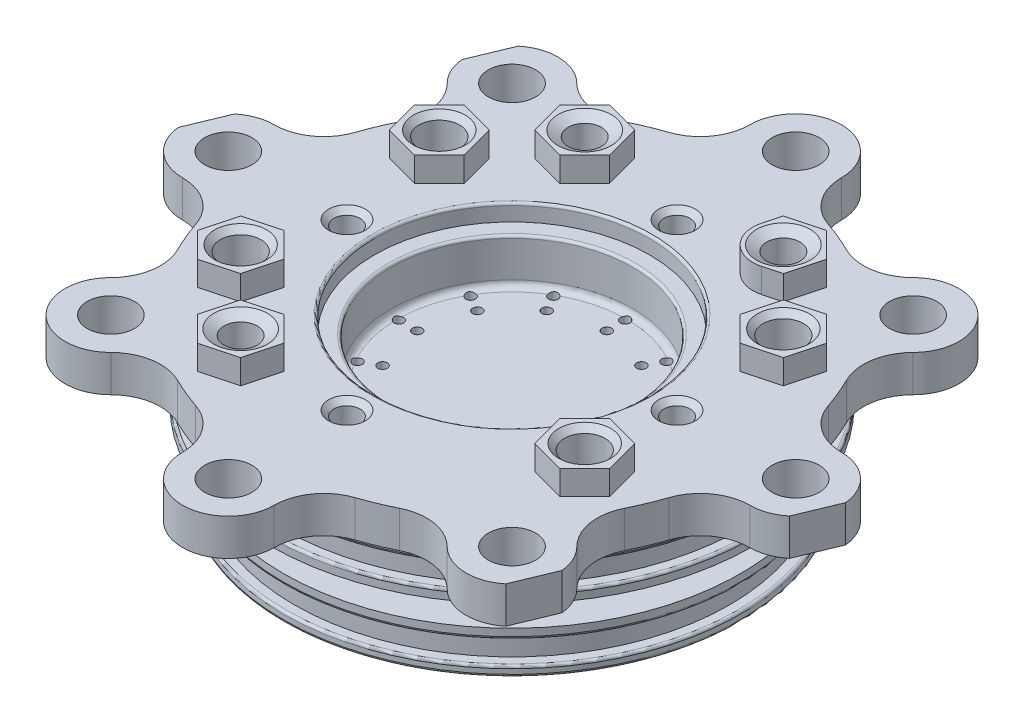
from build123d import *
from OCP.BRepFilletAPI import BRepFilletAPI_MakeChamfer

# Parameters (mm, degrees)
FILLET1_R                         = 0.508
FILLET2_R                         = 0.508
FILLET3_R                         = 1.27
FILLET4_R                         = 0.508
SKETCH3_R                         = 69.85
SKETCH3_R_2                       = 4.9022
CUT_EXTRUDE2_DEPTH                = 104.713322798
SKETCH6_R                         = 3.175
CUT_EXTRUDE3_DEPTH                = 102.850717495
CIRPATTERN1_COUNT                 = 12
F_5_64_24_HOLES_DEPTH             = 102.850717495
F_5_64_24_HOLES_DEPTH_BACK        = 102.850717495
SKETCH8_R                         = 0.9921875
SKETCH10_R                        = 0.75565
F_53_12_HOLES_DEPTH               = 132.251530064
SKETCH11_R                        = 0.75565
CUT_EXTRUDE6_DEPTH                = 102.498939104
CIRPATTERN2_COUNT                 = 12
SKETCH13_R                        = 0.2667
F_75_36_HOLES_DEPTH               = 131.167180714
CIRPATTERN3_COUNT                 = 36
SKETCH14_R                        = 0.2667
CUT_EXTRUDE8_DEPTH                = 10.16
BOSS_EXTRUDE4_DEPTH               = 5.08
F_3_8_24_TAPPED_HOLE1_D           = 8.4328
F_3_8_24_TAPPED_HOLE1_DEPTH       = 16.002
F_3_8_24_TAPPED_HOLE1_CSINK_D     = 10.795
F_3_8_24_TAPPED_HOLE1_CSINK_ANGLE = 90
F_3_8_24_TAPPED_HOLE1_TIP         = 2.533468714
F_1_4_28_TAPPED_HOLE3_D           = 5.4102
F_1_4_28_TAPPED_HOLE3_DEPTH       = 10.414
F_1_4_28_TAPPED_HOLE3_CSINK_D     = 7.62
F_1_4_28_TAPPED_HOLE3_CSINK_ANGLE = 90
F_1_4_28_TAPPED_HOLE3_TIP         = 1.625388061
BOSS_EXTRUDE3_START               = 31.5976
BOSS_EXTRUDE3_DEPTH               = 5.08
F_5_16_24_TAPPED_HOLE1_D          = 6.9088
F_5_16_24_TAPPED_HOLE1_DEPTH      = 12.7
F_5_16_24_TAPPED_HOLE1_TIP        = 2.075612922
CHAMFER1_SIZE                     = 2.1082
CHAMFER1_SIZE2                    = 1.217169838
SKETCH30_R                        = 0.79375
CUT_EXTRUDE9_DEPTH                = 16.4338
SKETCH33_R                        = 0.79375
CUT_EXTRUDE11_DEPTH               = 137.251138193
CUT_EXTRUDE12_DEPTH               = 104.539396706
CUT_EXTRUDE12_DEPTH_BACK          = 104.539396706


with BuildPart() as part:
    # Sketch1 → Revolve1 (revolve)
    with BuildSketch(Plane.XY, mode=Mode.PRIVATE) as revolve1_sk:
        Polygon((0, 2.032), (0, 18.8976), (25.1206, 18.8976), (25.1206, 28.1432), (28.575, 28.1432), (28.575, 31.5976), (69.85, 31.5976), (69.85, 23.9776), (50.248000088, 23.9776), (50.248000088, 21.9456), (47.962000088, 21.9456), (47.962000088, 17.1958), (50.248000088, 17.1958), (50.248000088, 15.1638), (38.1, 15.1638), (38.1, 8.8138), (47.498, 8.8138), (47.498, 6.7818), (45.212, 6.7818), (45.212, 2.032), (47.498, 2.032), (47.498, 0), (44.069, 0), (42.037, 2.032), align=None)
    revolve(revolve1_sk.sketch.rotate(Axis((0, 2.032, 0), (0, 1, 0)), 90), axis=Axis((0, 2.032, 0), (0, 1, 0)))

    # Fillet1
    fillet1_edges = [part.edges().sort_by_distance(p)[0] for p in [
        (0, 0, 47.498),
        (0, 2.032, 47.498),
        (0, 6.7818, 47.498),
        (0, 17.1958, 50.248000088),
        (0, 21.9456, 50.248000088),
    ]]
    fillet(fillet1_edges, radius=FILLET1_R)

    # Fillet2
    fillet2_edges = [part.edges().sort_by_distance(p)[0] for p in [
        (0, 2.032, 42.037),
        (0, 0, 44.069),
        (0, 8.8138, 38.1),
        (0, 15.1638, 38.1),
        (0, 23.9776, 50.248000088),
    ]]
    fillet(fillet2_edges, radius=FILLET2_R)

    # Fillet3
    fillet3_edges = [part.edges().sort_by_distance(p)[0] for p in [
        (0, 18.8976, 25.1206),
    ]]
    fillet(fillet3_edges, radius=FILLET3_R)

    # Fillet4
    fillet4_edges = [part.edges().sort_by_distance(p)[0] for p in [
        (0, 28.1432, 25.1206),
        (0, 31.5976, 28.575),
    ]]
    fillet(fillet4_edges, radius=FILLET4_R)

    # Sketch3 → Cut-Extrude2 (cut, through all)
    # profile 1 of 9: a face of its own
    with BuildSketch(Plane(origin=(0, 0, 0), x_dir=(1, 0, 0), z_dir=(0, 1, 0))):
        Circle(SKETCH3_R)
        with BuildLine():
            ThreePointArc((-49.16425059, -16.549685464), (-47.926250749, -19.851703054), (-46.466769802, -23.061980165))
            ThreePointArc((-46.466769802, -23.061980165), (-45.526960277, -29.315453551), (-48.412705792, -34.942321611))
            ThreePointArc((-48.412705792, -34.942321611), (-48.412705792, -48.412705792), (-34.942321611, -48.412705792))
            ThreePointArc((-34.942321611, -48.412705792), (-29.315453551, -45.526960277), (-23.061980165, -46.466769802))
            ThreePointArc((-23.061980165, -46.466769802), (-19.851703054, -47.926250749), (-16.549685464, -49.16425059))
            ThreePointArc((-16.549685464, -49.16425059), (-11.463266339, -52.921578338), (-9.525, -58.940905122))
            ThreePointArc((-9.525, -58.940905122), (0, -68.465905122), (9.525, -58.940905122))
            ThreePointArc((9.525, -58.940905122), (11.463266339, -52.921578338), (16.549685464, -49.16425059))
            ThreePointArc((16.549685464, -49.16425059), (19.851703054, -47.926250749), (23.061980165, -46.466769802))
            ThreePointArc((23.061980165, -46.466769802), (29.315453551, -45.526960277), (34.942321611, -48.412705792))
            ThreePointArc((34.942321611, -48.412705792), (48.412705792, -48.412705792), (48.412705792, -34.942321611))
            ThreePointArc((48.412705792, -34.942321611), (45.526960277, -29.315453551), (46.466769802, -23.061980165))
            ThreePointArc((46.466769802, -23.061980165), (47.926250749, -19.851703054), (49.16425059, -16.549685464))
            ThreePointArc((49.16425059, -16.549685464), (52.921578338, -11.463266339), (58.940905122, -9.525))
            ThreePointArc((58.940905122, -9.525), (68.465905122, 0), (58.940905122, 9.525))
            ThreePointArc((58.940905122, 9.525), (52.921578338, 11.463266339), (49.16425059, 16.549685464))
            ThreePointArc((49.16425059, 16.549685464), (47.926250749, 19.851703054), (46.466769802, 23.061980165))
            ThreePointArc((46.466769802, 23.061980165), (45.526960277, 29.315453551), (48.412705792, 34.942321611))
            ThreePointArc((48.412705792, 34.942321611), (48.412705792, 48.412705792), (34.942321611, 48.412705792))
            ThreePointArc((34.942321611, 48.412705792), (29.315453551, 45.526960277), (23.061980165, 46.466769802))
            ThreePointArc((23.061980165, 46.466769802), (19.851703054, 47.926250749), (16.549685464, 49.16425059))
            ThreePointArc((16.549685464, 49.16425059), (11.463266339, 52.921578338), (9.525, 58.940905122))
            ThreePointArc((9.525, 58.940905122), (0, 68.465905122), (-9.525, 58.940905122))
            ThreePointArc((-9.525, 58.940905122), (-11.463266339, 52.921578338), (-16.549685464, 49.16425059))
            ThreePointArc((-16.549685464, 49.16425059), (-19.851703054, 47.926250749), (-23.061980165, 46.466769802))
            ThreePointArc((-23.061980165, 46.466769802), (-29.315453551, 45.526960277), (-34.942321611, 48.412705792))
            ThreePointArc((-34.942321611, 48.412705792), (-48.412705792, 48.412705792), (-48.412705792, 34.942321611))
            ThreePointArc((-48.412705792, 34.942321611), (-45.526960277, 29.315453551), (-46.466769802, 23.061980165))
            ThreePointArc((-46.466769802, 23.061980165), (-47.926250749, 19.851703054), (-49.16425059, 16.549685464))
            ThreePointArc((-49.16425059, 16.549685464), (-52.921578338, 11.463266339), (-58.940905122, 9.525))
            ThreePointArc((-58.940905122, 9.525), (-68.465905122, 0), (-58.940905122, -9.525))
            ThreePointArc((-58.940905122, -9.525), (-52.921578338, -11.463266339), (-49.16425059, -16.549685464))
        make_face(mode=Mode.SUBTRACT)
    # profile 2 of 9: a face of its own
    with BuildSketch(Plane(origin=(0, 0, 0), x_dir=(1, 0, 0), z_dir=(0, 1, 0))):
        with Locations(Location((58.940905122, 0, 0), (0, 0, 90))):
            Circle(SKETCH3_R_2)
    # profile 3 of 9: a face of its own
    with BuildSketch(Plane(origin=(0, 0, 0), x_dir=(1, 0, 0), z_dir=(0, 1, 0))):
        with Locations(Location((41.677513701, -41.677513701, 0), (0, 0, 90))):
            Circle(SKETCH3_R_2)
    # profile 4 of 9: a face of its own
    with BuildSketch(Plane(origin=(0, 0, 0), x_dir=(1, 0, 0), z_dir=(0, 1, 0))):
        with Locations(Location((0, -58.940905122, 0), (0, 0, 90))):
            Circle(SKETCH3_R_2)
    # profile 5 of 9: a face of its own
    with BuildSketch(Plane(origin=(0, 0, 0), x_dir=(1, 0, 0), z_dir=(0, 1, 0))):
        with Locations(Location((41.677513701, 41.677513701, 0), (0, 0, 90))):
            Circle(SKETCH3_R_2)
    # profile 6 of 9: a face of its own
    with BuildSketch(Plane(origin=(0, 0, 0), x_dir=(1, 0, 0), z_dir=(0, 1, 0))):
        with Locations(Location((0, 58.940905122, 0), (0, 0, 90))):
            Circle(SKETCH3_R_2)
    # profile 7 of 9: a face of its own
    with BuildSketch(Plane(origin=(0, 0, 0), x_dir=(1, 0, 0), z_dir=(0, 1, 0))):
        with Locations(Location((-41.677513701, 41.677513701, 0), (0, 0, 90))):
            Circle(SKETCH3_R_2)
    # profile 8 of 9: a face of its own
    with BuildSketch(Plane(origin=(0, 0, 0), x_dir=(1, 0, 0), z_dir=(0, 1, 0))):
        with Locations(Location((-58.940905122, 0, 0), (0, 0, 90))):
            Circle(SKETCH3_R_2)
    # profile 9 of 9: a face of its own
    with BuildSketch(Plane(origin=(0, 0, 0), x_dir=(1, 0, 0), z_dir=(0, 1, 0))):
        with Locations(Location((-41.677513701, -41.677513701, 0), (0, 0, 90))):
            Circle(SKETCH3_R_2)
    extrude(amount=CUT_EXTRUDE2_DEPTH, mode=Mode.SUBTRACT)

    # Sketch6 → Cut-Extrude3 (cut, symmetric)
    with BuildSketch(Plane(origin=(0, 0, 0), x_dir=(0.25881904510252135, 0, -0.9659258262890681), z_dir=(0.9659258262890681, 0, 0.25881904510252135))):
        with Locations(Location((0, 11.9888, 0), (0, 0, 57.140119621))):
            Circle(SKETCH6_R)
    cut_extrude3 = extrude(amount=CUT_EXTRUDE3_DEPTH, both=True, mode=Mode.SUBTRACT)

    # CirPattern1: Cut-Extrude3 ×12 about axis
    cirpattern1_axis = Axis((0, 0, 0), (0, 1, 0))
    for i in range(1, CIRPATTERN1_COUNT):
        add(cut_extrude3.rotate(cirpattern1_axis, i * 360 / CIRPATTERN1_COUNT), mode=Mode.SUBTRACT)

    # Sketch8 → 5/64 - 24 holes (cut, two sides: drawn at the far end of the back side and taken through both)
    with BuildSketch(Plane(origin=(0, 0, 0), x_dir=(1, 0, 0), z_dir=(0, 1, 0)).offset(-F_5_64_24_HOLES_DEPTH_BACK)):
        with Locations(Location((0, 19.685, 0), (0, 0, 270))):
            Circle(SKETCH8_R)
        with Locations(Location((0, 23.495, 0), (0, 0, 160.1232873))):
            Circle(SKETCH8_R)
        with Locations(Location((11.7475, 20.347266862, 0), (0, 0, 349.8767127))):
            Circle(SKETCH8_R)
        with Locations(Location((9.8425, 17.047710073, 0), (0, 0, 270))):
            Circle(SKETCH8_R)
        with Locations(Location((20.347266862, 11.7475, 0), (0, 0, 319.8767127))):
            Circle(SKETCH8_R)
        with Locations(Location((17.047710073, 9.8425, 0), (0, 0, 270))):
            Circle(SKETCH8_R)
        with Locations(Location((23.495, 0, 0), (0, 0, 289.8767127))):
            Circle(SKETCH8_R)
        with Locations(Location((19.685, 0, 0), (0, 0, 270))):
            Circle(SKETCH8_R)
        with Locations(Location((20.347266862, -11.7475, 0), (0, 0, 259.8767127))):
            Circle(SKETCH8_R)
        with Locations(Location((17.047710073, -9.8425, 0), (0, 0, 270))):
            Circle(SKETCH8_R)
        with Locations(Location((11.7475, -20.347266862, 0), (0, 0, 229.8767127))):
            Circle(SKETCH8_R)
        with Locations(Location((9.8425, -17.047710073, 0), (0, 0, 270))):
            Circle(SKETCH8_R)
        with Locations(Location((0, -23.495, 0), (0, 0, 270))):
            Circle(SKETCH8_R)
        with Locations(Location((0, -19.685, 0), (0, 0, 270))):
            Circle(SKETCH8_R)
        with Locations(Location((-11.7475, -20.347266862, 0), (0, 0, 310.1232873))):
            Circle(SKETCH8_R)
        with Locations(Location((-9.8425, -17.047710073, 0), (0, 0, 270))):
            Circle(SKETCH8_R)
        with Locations(Location((-20.347266862, -11.7475, 0), (0, 0, 280.1232873))):
            Circle(SKETCH8_R)
        with Locations(Location((-17.047710073, -9.8425, 0), (0, 0, 270))):
            Circle(SKETCH8_R)
        with Locations(Location((-23.495, 0, 0), (0, 0, 250.1232873))):
            Circle(SKETCH8_R)
        with Locations(Location((-19.685, 0, 0), (0, 0, 270))):
            Circle(SKETCH8_R)
        with Locations(Location((-20.347266862, 11.7475, 0), (0, 0, 220.1232873))):
            Circle(SKETCH8_R)
        with Locations(Location((-17.047710073, 9.8425, 0), (0, 0, 270))):
            Circle(SKETCH8_R)
        with Locations(Location((-11.7475, 20.347266862, 0), (0, 0, 190.1232873))):
            Circle(SKETCH8_R)
        with Locations(Location((-9.8425, 17.047710073, 0), (0, 0, 270))):
            Circle(SKETCH8_R)
    extrude(amount=F_5_64_24_HOLES_DEPTH + F_5_64_24_HOLES_DEPTH_BACK, mode=Mode.SUBTRACT)

    # Sketch10 → #53 - 12 holes (cut, through all)
    with BuildSketch(Plane(origin=(41.932963023, 12.849963023, 0), x_dir=(-0.707106781186554, 0.7071067811865411, 0), z_dir=(-0.7071067811865411, -0.707106781186554, 0))):
        with Locations(Location((0, 0, 0), (0, 0, 286.955923901))):
            Circle(SKETCH10_R)
    f_53_12_holes = extrude(amount=F_53_12_HOLES_DEPTH, mode=Mode.SUBTRACT)

    # Sketch11 → Cut-Extrude6 (cut, through all)
    with BuildSketch(Plane(origin=(3.469536977, 10.627463023, 0), x_dir=(0, 0, -1), z_dir=(0.707106781186556, -0.707106781186539, 0))):
        with Locations(Location((0, 0, 0), (0, 0, 270))):
            Circle(SKETCH11_R)
    cut_extrude6 = extrude(amount=CUT_EXTRUDE6_DEPTH, mode=Mode.SUBTRACT)

    # CirPattern2: #53 - 12 holes, Cut-Extrude6 ×12 about axis
    cirpattern2_axis = Axis((0, 8.8138, 0), (0, -1, 0))
    add([f_53_12_holes.rotate(cirpattern2_axis, i * 360 / CIRPATTERN2_COUNT) for i in range(1, CIRPATTERN2_COUNT)], mode=Mode.SUBTRACT)
    add([cut_extrude6.rotate(cirpattern2_axis, i * 360 / CIRPATTERN2_COUNT) for i in range(1, CIRPATTERN2_COUNT)], mode=Mode.SUBTRACT)

    # Sketch13 → #75 - 36 holes (cut, through all)
    with BuildSketch(Plane(origin=(40.431930952, 11.668323318, 0), x_dir=(-0.9961946980917462, -0.08715574274765178, 0), z_dir=(0.08715574274765178, -0.9961946980917462, 0))):
        Circle(SKETCH13_R)
    f_75_36_holes = extrude(amount=F_75_36_HOLES_DEPTH, mode=Mode.SUBTRACT)

    # CirPattern3: #75 - 36 holes ×36 about axis
    cirpattern3_axis = Axis((0, 15.1638, 0), (0, -1, 0))
    for i in range(1, CIRPATTERN3_COUNT):
        add(f_75_36_holes.rotate(cirpattern3_axis, i * 360 / CIRPATTERN3_COUNT), mode=Mode.SUBTRACT)

    # Sketch14 → Cut-Extrude8 (cut)
    with BuildSketch(Plane(origin=(0, 0, 0), x_dir=(1, 0, 0), z_dir=(0, 1, 0))):
        with Locations(Location((0, 0, 0), (0, 0, 90))):
            Circle(SKETCH14_R)
    extrude(amount=CUT_EXTRUDE8_DEPTH, mode=Mode.SUBTRACT)

    # Sketch40 → Boss-Extrude4 (add)
    with BuildSketch(Plane(origin=(0, 31.5976, 0), x_dir=(1, 0, 0), z_dir=(0, 1, 0))):
        Polygon((-30.560445252, 25.822253289), (-37.642949957, 27.720004705), (-42.827703246, 22.535251416), (-40.92995183, 15.452746711), (-33.847447125, 13.554995295), (-28.662693836, 18.739748584), align=None)
        Polygon((-33.847447125, -13.554995295), (-40.92995183, -15.452746711), (-42.827703246, -22.535251416), (-37.642949957, -27.720004705), (-30.560445252, -25.822253289), (-28.662693836, -18.739748584), align=None)
        Polygon((40.92995183, -15.452746711), (33.847447125, -13.554995295), (28.662693836, -18.739748584), (30.560445252, -25.822253289), (37.642949957, -27.720004705), (42.827703246, -22.535251416), align=None)
        Polygon((37.642949957, 27.720004705), (30.560445252, 25.822253289), (28.662693836, 18.739748584), (33.847447125, 13.554995295), (40.92995183, 15.452746711), (42.827703246, 22.535251416), align=None)
    extrude(amount=BOSS_EXTRUDE4_DEPTH)

    # 3/8-24 Tapped Hole1
    with Locations(Plane(origin=(0, 36.6776, 0), x_dir=(1, 0, 0), z_dir=(0, 1, 0))):
        with Locations((35.745198541, -20.6375), (35.745198541, 20.6375), (-35.745198541, 20.6375), (-35.745198541, -20.6375)):
            CounterSinkHole(F_3_8_24_TAPPED_HOLE1_D / 2, F_3_8_24_TAPPED_HOLE1_CSINK_D / 2, depth=F_3_8_24_TAPPED_HOLE1_DEPTH, counter_sink_angle=F_3_8_24_TAPPED_HOLE1_CSINK_ANGLE)
            with Locations((0, 0, -(F_3_8_24_TAPPED_HOLE1_DEPTH + F_3_8_24_TAPPED_HOLE1_TIP / 2))):  # 118° drill point
                Cone(0, F_3_8_24_TAPPED_HOLE1_D / 2, F_3_8_24_TAPPED_HOLE1_TIP, mode=Mode.SUBTRACT)

    # 1/4-28 Tapped Hole3
    with Locations(Plane(origin=(0, 31.5976, 0), x_dir=(1, 0, 0), z_dir=(0, 1, 0))):
        with Locations((0, 34.29), (34.29, 0), (0, -34.29), (-34.29, 0)):
            CounterSinkHole(F_1_4_28_TAPPED_HOLE3_D / 2, F_1_4_28_TAPPED_HOLE3_CSINK_D / 2, depth=F_1_4_28_TAPPED_HOLE3_DEPTH, counter_sink_angle=F_1_4_28_TAPPED_HOLE3_CSINK_ANGLE)
            with Locations((0, 0, -(F_1_4_28_TAPPED_HOLE3_DEPTH + F_1_4_28_TAPPED_HOLE3_TIP / 2))):  # 118° drill point
                Cone(0, F_1_4_28_TAPPED_HOLE3_D / 2, F_1_4_28_TAPPED_HOLE3_TIP, mode=Mode.SUBTRACT)

    # Sketch27 → Boss-Extrude3 (add)
    with BuildSketch(Plane(origin=(0, 0, 0), x_dir=(1, 0, 0), z_dir=(0, 1, 0)).offset(BOSS_EXTRUDE3_START)):
        Polygon((-22.535251416, 42.827703246), (-27.720004705, 37.642949957), (-25.822253289, 30.560445252), (-18.739748584, 28.662693836), (-13.554995295, 33.847447125), (-15.452746711, 40.92995183), align=None)
        with BuildLine():
            Line((27.720004705, 37.642949957), (22.535251416, 42.827703246))
            Line((22.535251416, 42.827703246), (15.452746711, 40.92995183))
            Line((15.452746711, 40.92995183), (14.503871003, 37.388699478))
            ThreePointArc((14.503871003, 37.388699478), (16.147371939, 31.255070481), (22.281000936, 29.611569544))
            Line((22.281000936, 29.611569544), (25.822253289, 30.560445252))
            Line((25.822253289, 30.560445252), (27.720004705, 37.642949957))
        make_face()
        Polygon((-13.554995295, -33.847447125), (-18.739748584, -28.662693836), (-25.822253289, -30.560445252), (-27.720004705, -37.642949957), (-22.535251416, -42.827703246), (-15.452746711, -40.92995183), align=None)
    extrude(amount=BOSS_EXTRUDE3_DEPTH)

    # 5/16-24 Tapped Hole1
    with Locations(Plane(origin=(0, 36.6776, 0), x_dir=(1, 0, 0), z_dir=(0, 1, 0))):
        with Locations((-20.6375, -35.745198541), (-20.6375, 35.745198541), (20.6375, 35.745198541)):
            Hole(F_5_16_24_TAPPED_HOLE1_D / 2, depth=F_5_16_24_TAPPED_HOLE1_DEPTH)
            with Locations((0, 0, -(F_5_16_24_TAPPED_HOLE1_DEPTH + F_5_16_24_TAPPED_HOLE1_TIP / 2))):  # 118° drill point
                Cone(0, F_5_16_24_TAPPED_HOLE1_D / 2, F_5_16_24_TAPPED_HOLE1_TIP, mode=Mode.SUBTRACT)

    # Chamfer1: one chamfer whose edges measure the first distance from different faces: ONE call of the kernel's chamfer builder (chamfer() names one face for all edges)
    chamfer1_edges_1 = [part.edges().sort_by_distance(p)[0] for p in [
        (24.0919, 36.6776, -35.745198541),
    ]]
    chamfer1_side_1 = [part.faces().sort_by_distance(p)[0] for p in [
        (24.993303013, 36.6776, -40.101001555),
    ]]
    chamfer1_edges_2 = [part.edges().sort_by_distance(p)[0] for p in [
        (-17.1831, 36.6776, -35.745198541),
    ]]
    chamfer1_side_2 = [part.faces().sort_by_distance(p)[0] for p in [
        (-24.985977966, 36.6776, -40.093676508),
    ]]
    chamfer1_edges_3 = [part.edges().sort_by_distance(p)[0] for p in [
        (-17.1831, 36.6776, 35.745198541),
    ]]
    chamfer1_side_3 = [part.faces().sort_by_distance(p)[0] for p in [
        (-16.289022034, 36.6776, 31.396720575),
    ]]
    chamfer1 = BRepFilletAPI_MakeChamfer(part.part.solid().wrapped)
    for e in chamfer1_edges_1:
        chamfer1.Add(CHAMFER1_SIZE, CHAMFER1_SIZE2, e.wrapped, chamfer1_side_1[0].wrapped)  # the first distance lies on this face
    for e in chamfer1_edges_2:
        chamfer1.Add(CHAMFER1_SIZE, CHAMFER1_SIZE2, e.wrapped, chamfer1_side_2[0].wrapped)  # the first distance lies on this face
    for e in chamfer1_edges_3:
        chamfer1.Add(CHAMFER1_SIZE, CHAMFER1_SIZE2, e.wrapped, chamfer1_side_3[0].wrapped)  # the first distance lies on this face
    add(Compound.cast(chamfer1.Shape()), mode=Mode.REPLACE)

    # Sketch30 → Cut-Extrude9 (cut)
    with BuildSketch(Plane(origin=(0, 31.5976, 0), x_dir=(1, 0, 0), z_dir=(0, 1, 0))):
        with Locations(Location((-20.6375, 35.745198541, 0), (0, 0, 270))):
            Circle(SKETCH30_R)
        with Locations(Location((-20.6375, -35.745198541, 0), (0, 0, 270))):
            Circle(SKETCH30_R)
    extrude(amount=-CUT_EXTRUDE9_DEPTH, mode=Mode.SUBTRACT)

    # Sketch33 → Cut-Extrude11 (cut, through all)
    with BuildSketch(Plane(origin=(19.109422392, 24.075053775, -33.098490486), x_dir=(-0.9774192811740606, 0.19593547464063193, -0.07912546092461675), z_dir=(-0.21130913087035016, -0.9063077870366495, 0.3659981507706679))):
        with Locations(Location((0, 0, 0), (0, 0, 234.467238106))):
            Circle(SKETCH33_R)
    extrude(amount=CUT_EXTRUDE11_DEPTH, mode=Mode.SUBTRACT)

    # Sketch42 → Cut-Extrude12 (cut, two sides: drawn at the far end of the back side and taken through both)
    with BuildSketch(Plane(origin=(0, 0, 0), x_dir=(1, 0, 0), z_dir=(0, 1, 0)).offset(-CUT_EXTRUDE12_DEPTH_BACK)):
        Polygon((-73.775976367, -13.836801149), (-44.026118762, 57.98570856), (-58.183576903, 63.849919731), (-87.933434509, -7.972589978), align=None)
        Polygon((73.775976367, 13.836801149), (44.026118762, -57.98570856), (58.183576903, -63.849919731), (87.933434509, 7.972589978), align=None)
    extrude(amount=CUT_EXTRUDE12_DEPTH + CUT_EXTRUDE12_DEPTH_BACK, mode=Mode.SUBTRACT)


solid = part.part
